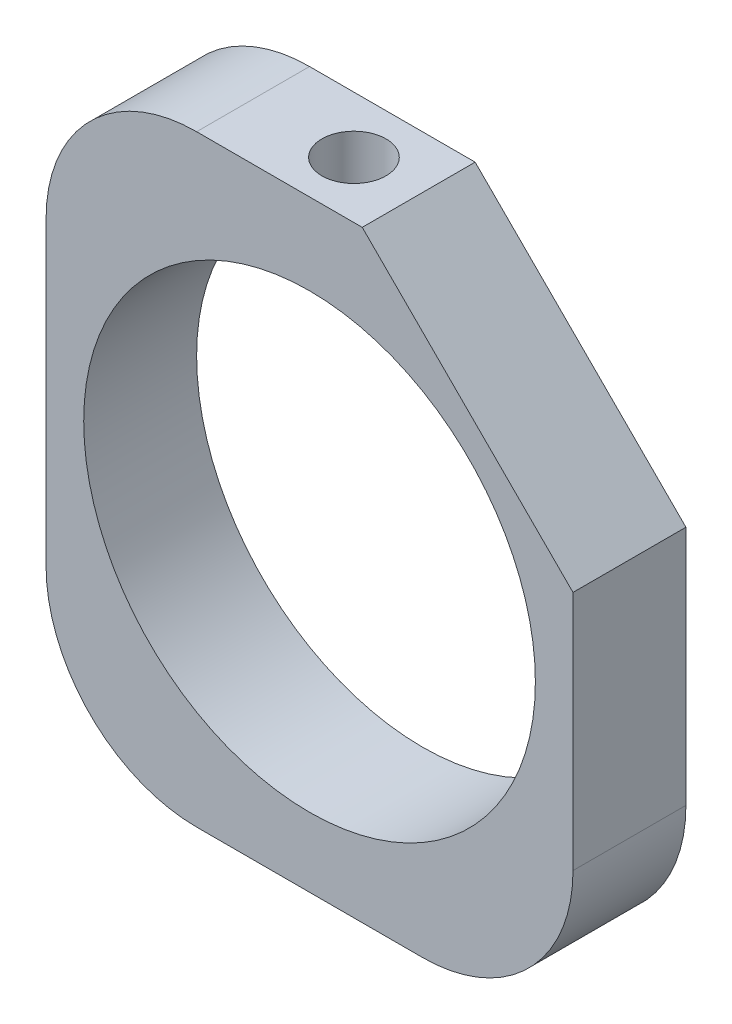
from build123d import *

# Parameters (mm, degrees)
SKETCH1_R                     = 9.525
BOSS_EXTRUDE2_DEPTH           = 4.7625
TAP_DRILL_FOR_6_32_TAP1_D     = 2.7051
TAP_DRILL_FOR_6_32_TAP1_DEPTH = 19.05
TAP_DRILL_FOR_6_32_TAP1_TIP   = 0.81269403
CHAMFER1_SIZE                 = 8.89


with BuildPart() as part:
    # Sketch1 → Boss-Extrude2 (new body)
    with BuildSketch(Plane.XY):
        with BuildLine():
            ThreePointArc((-4.7625, 12.954), (-9.252628061, 11.094128061), (-11.1125, 6.604))
            Line((-11.1125, 6.604), (-11.1125, -6.096))
            ThreePointArc((-11.1125, -6.096), (-9.252628061, -10.586128061), (-4.7625, -12.446))
            Line((-4.7625, -12.446), (4.7625, -12.446))
            ThreePointArc((4.7625, -12.446), (9.252628061, -10.586128061), (11.1125, -6.096))
            Line((11.1125, -6.096), (11.1125, 12.954))
            Line((11.1125, 12.954), (-4.7625, 12.954))
        make_face()
        Circle(SKETCH1_R, mode=Mode.SUBTRACT)
    extrude(amount=BOSS_EXTRUDE2_DEPTH)

    # Tap Drill for #6-32 Tap1
    with Locations(Plane(origin=(0, 12.954, 0), x_dir=(1, 0, 0), z_dir=(0, 1, 0))):
        with Locations((-0.508, -2.38125)):
            Hole(TAP_DRILL_FOR_6_32_TAP1_D / 2, depth=TAP_DRILL_FOR_6_32_TAP1_DEPTH)
            with Locations((0, 0, -(TAP_DRILL_FOR_6_32_TAP1_DEPTH + TAP_DRILL_FOR_6_32_TAP1_TIP / 2))):  # 118° drill point
                Cone(0, TAP_DRILL_FOR_6_32_TAP1_D / 2, TAP_DRILL_FOR_6_32_TAP1_TIP, mode=Mode.SUBTRACT)

    # Chamfer1
    chamfer1_edges = [part.edges().sort_by_distance(p)[0] for p in [
        (11.1125, 12.954, 2.38125),
    ]]
    chamfer(chamfer1_edges, length=CHAMFER1_SIZE)


solid = part.part
